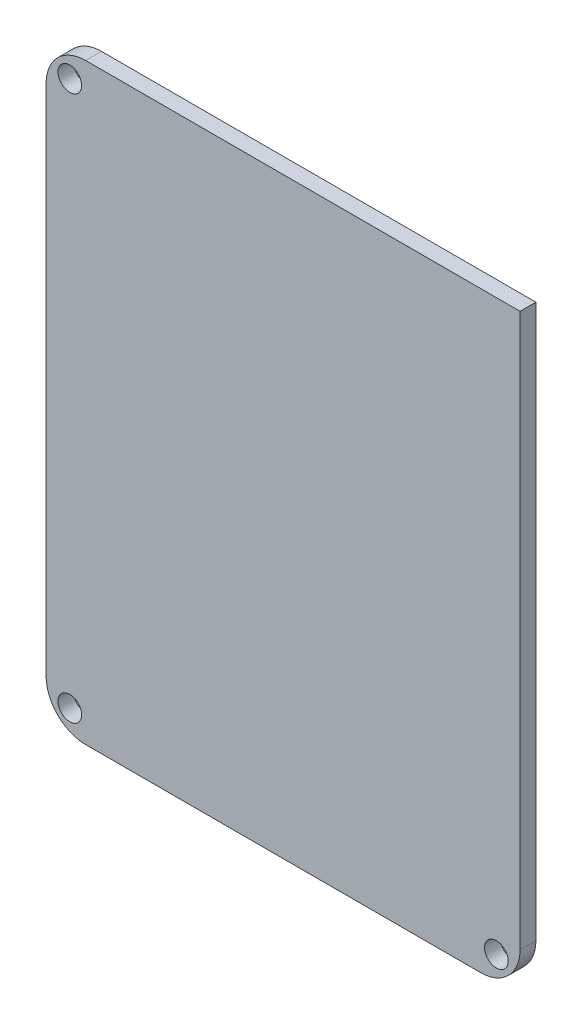
from build123d import *

# Parameters (mm, degrees)
SKETCH1_W           = 60
SKETCH1_H           = 75
BOSS_EXTRUDE1_DEPTH = 2
SKETCH2_R           = 1.5
CUT_EXTRUDE1_DEPTH  = 2
FILLET1_R           = 5


with BuildPart() as part:
    # Sketch1 → Boss-Extrude1 (new body)
    with BuildSketch(Plane.XY):
        with Locations((-23.906734616, 32.298472976)):
            Rectangle(SKETCH1_W, SKETCH1_H)
    extrude(amount=BOSS_EXTRUDE1_DEPTH)

    # Sketch2 → Cut-Extrude1 (cut)
    with BuildSketch(Plane.XY.offset(2)):
        with Locations((-50.906734616, -2.201527024)):
            Circle(SKETCH2_R)
        with Locations((3.093265384, -2.201527024)):
            Circle(SKETCH2_R)
        with Locations((-50.906734616, 66.798472976)):
            Circle(SKETCH2_R)
    extrude(amount=-CUT_EXTRUDE1_DEPTH, mode=Mode.SUBTRACT)

    # Fillet1
    fillet1_edges = [part.edges().sort_by_distance(p)[0] for p in [
        (6.093265384, -5.201527024, 1),
        (-53.906734616, -5.201527024, 1),
        (-53.906734616, 69.798472976, 1),
    ]]
    fillet(fillet1_edges, radius=FILLET1_R)


solid = part.part
